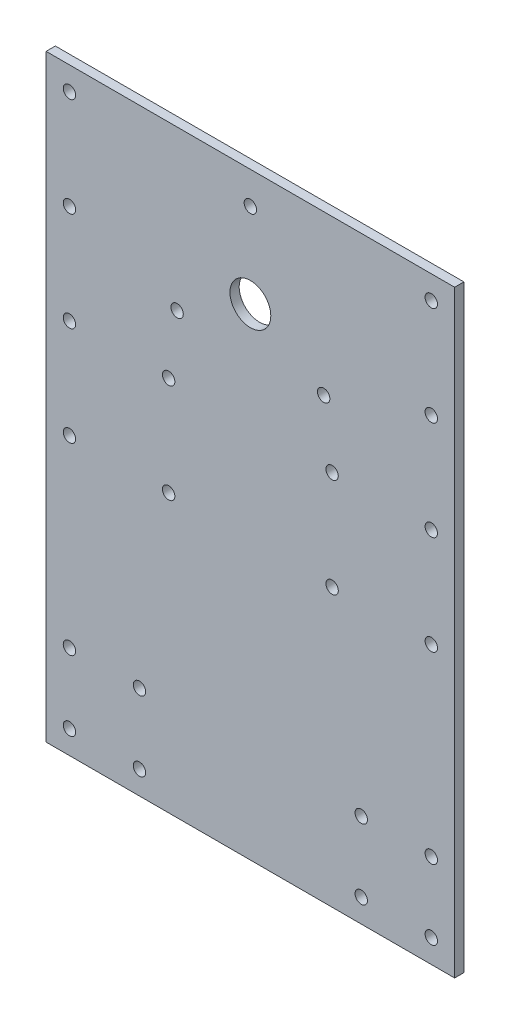
from build123d import *

# Parameters (mm, degrees)
SKETCH1_W           = 140
SKETCH1_H           = 205
SKETCH1_R           = 2.125
SKETCH1_R_2         = 7
BOSS_EXTRUDE1_DEPTH = 3.175
SKETCH2_R           = 2.125
CUT_EXTRUDE1_DEPTH  = 125.162516989


with BuildPart() as part:
    # Sketch1 → Boss-Extrude1 (new body)
    with BuildSketch(Plane.XY):
        Rectangle(SKETCH1_W, SKETCH1_H)
        with Locations((0, 91.5)):
            Circle(SKETCH1_R, mode=Mode.SUBTRACT)
        with Locations((25.11473671, 48)):
            Circle(SKETCH1_R, mode=Mode.SUBTRACT)
        with Locations((-25.11473671, 48)):
            Circle(SKETCH1_R, mode=Mode.SUBTRACT)
        with Locations((0, 62.5)):
            Circle(SKETCH1_R_2, mode=Mode.SUBTRACT)
        with Locations((-62, -94.5)):
            Circle(SKETCH1_R, mode=Mode.SUBTRACT)
        with Locations((-38, -94.5)):
            Circle(SKETCH1_R, mode=Mode.SUBTRACT)
        with Locations((-38, -70.5)):
            Circle(SKETCH1_R, mode=Mode.SUBTRACT)
        with Locations((-62, -70.5)):
            Circle(SKETCH1_R, mode=Mode.SUBTRACT)
        with Locations((38, -94.5)):
            Circle(SKETCH1_R, mode=Mode.SUBTRACT)
        with Locations((62, -94.5)):
            Circle(SKETCH1_R, mode=Mode.SUBTRACT)
        with Locations((62, -70.5)):
            Circle(SKETCH1_R, mode=Mode.SUBTRACT)
        with Locations((38, -70.5)):
            Circle(SKETCH1_R, mode=Mode.SUBTRACT)
    extrude(amount=BOSS_EXTRUDE1_DEPTH)

    # Sketch2 → Cut-Extrude1 (cut, through all)
    with BuildSketch(Plane.XY.offset(3.175)):
        with Locations((-62, 94.5)):
            Circle(SKETCH2_R)
        with Locations((-62, 60.5)):
            Circle(SKETCH2_R)
        with Locations((-62, 26.5)):
            Circle(SKETCH2_R)
        with Locations((-62, -7.5)):
            Circle(SKETCH2_R)
        with Locations((-28, 26.5)):
            Circle(SKETCH2_R)
        with Locations((-28, -7.5)):
            Circle(SKETCH2_R)
        with Locations((28, -7.5)):
            Circle(SKETCH2_R)
        with Locations((28, 26.5)):
            Circle(SKETCH2_R)
        with Locations((62, -7.5)):
            Circle(SKETCH2_R)
        with Locations((62, 26.5)):
            Circle(SKETCH2_R)
        with Locations((62, 60.5)):
            Circle(SKETCH2_R)
        with Locations((62, 94.5)):
            Circle(SKETCH2_R)
    extrude(amount=-CUT_EXTRUDE1_DEPTH, mode=Mode.SUBTRACT)


solid = part.part
